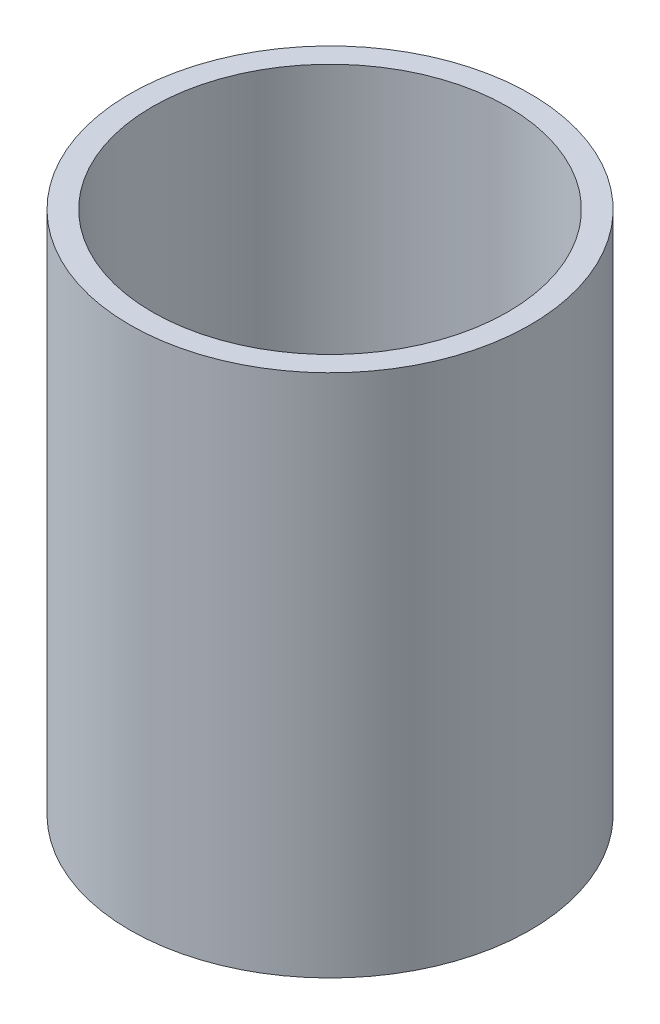
from build123d import *

# Parameters (mm, degrees)
SKETCH1_R           = 40
BOSS_EXTRUDE1_DEPTH = 104.74064504
SKETCH2_R           = 35.525650353
CUT_EXTRUDE1_DEPTH  = 120.04034074


with BuildPart() as part:
    # Sketch1 → Boss-Extrude1 (new body)
    with BuildSketch(Plane(origin=(0, 0, 0), x_dir=(1, 0, 0), z_dir=(0, 1, 0))):
        Circle(SKETCH1_R)
    extrude(amount=BOSS_EXTRUDE1_DEPTH)

    # Sketch2 → Cut-Extrude1 (cut, through all)
    with BuildSketch(Plane(origin=(0, 0, 0), x_dir=(1, 0, 0), z_dir=(0, 1, 0))):
        Circle(SKETCH2_R)
    extrude(amount=CUT_EXTRUDE1_DEPTH, mode=Mode.SUBTRACT)


solid = part.part
